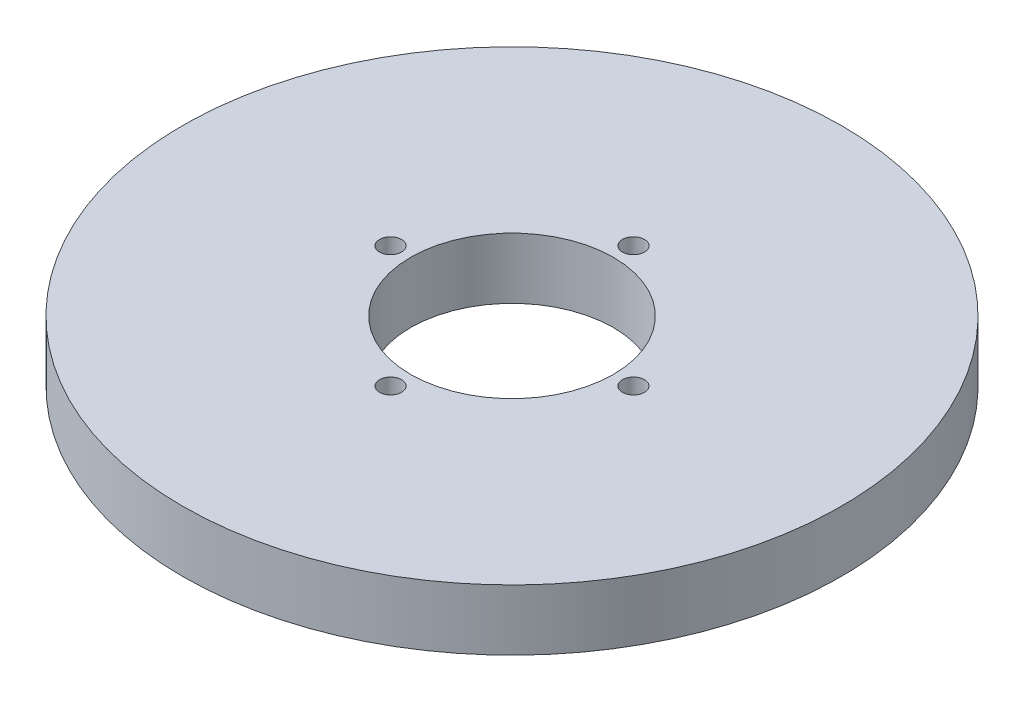
from build123d import *

# Parameters (mm, degrees)
SKETCH1_R           = 97.5
BOSS_EXTRUDE1_DEPTH = 18
SKETCH2_R           = 30
CUT_EXTRUDE1_DEPTH  = 140.055744218
SKETCH3_R           = 3.254395641
CUT_EXTRUDE2_DEPTH  = 15.062750466
CIRPATTERN1_COUNT   = 4


with BuildPart() as part:
    # Sketch1 → Boss-Extrude1 (new body)
    with BuildSketch(Plane(origin=(0, 0, 0), x_dir=(1, 0, 0), z_dir=(0, 1, 0))):
        Circle(SKETCH1_R)
    extrude(amount=BOSS_EXTRUDE1_DEPTH)

    # Sketch2 → Cut-Extrude1 (cut, through all)
    with BuildSketch(Plane(origin=(0, 0, 0), x_dir=(1, 0, 0), z_dir=(0, 1, 0))):
        Circle(SKETCH2_R)
    extrude(amount=CUT_EXTRUDE1_DEPTH, mode=Mode.SUBTRACT)

    # Sketch3 → Cut-Extrude2 (cut)
    with BuildSketch(Plane(origin=(0, 18, 0), x_dir=(1, 0, 0), z_dir=(0, 1, 0))):
        with Locations((-35.935879581, 0)):
            Circle(SKETCH3_R)
    cut_extrude2 = extrude(amount=-CUT_EXTRUDE2_DEPTH, mode=Mode.SUBTRACT)

    # CirPattern1: Cut-Extrude2 ×4 about axis
    cirpattern1_axis = Axis((0, 0, 0), (0, 1, 0))
    for i in range(1, CIRPATTERN1_COUNT):
        add(cut_extrude2.rotate(cirpattern1_axis, i * 360 / CIRPATTERN1_COUNT), mode=Mode.SUBTRACT)


solid = part.part
